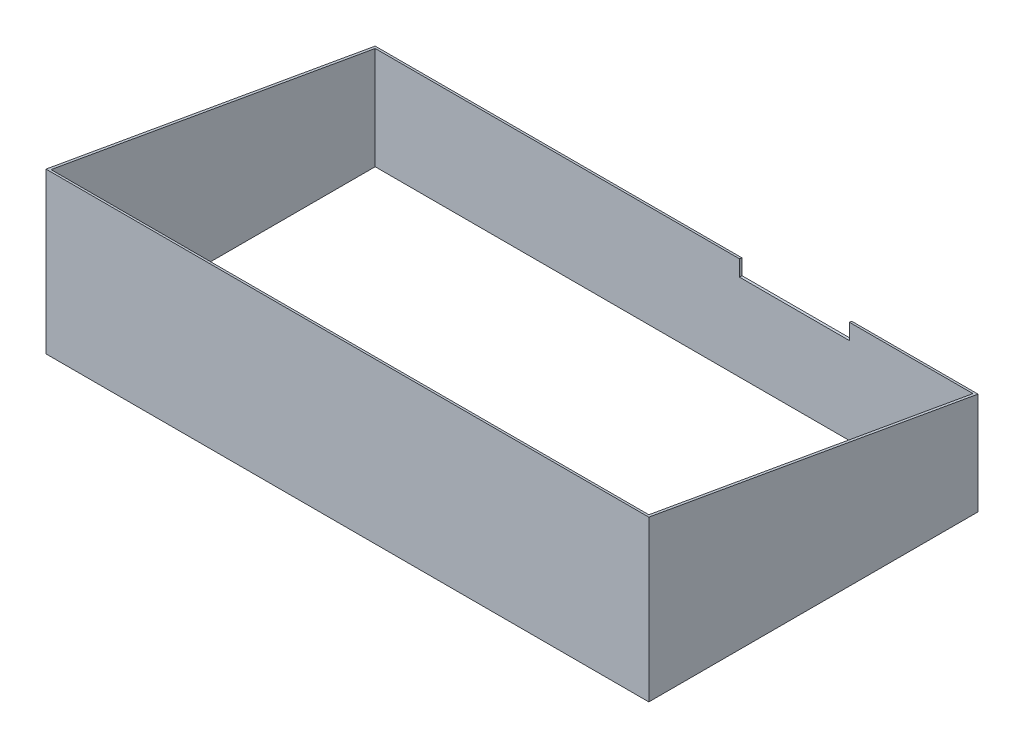
from build123d import *

# Parameters (mm, degrees)
BOSS_EXTRUDE1_DEPTH      = 759.38
BOSS_EXTRUDE1_DEPTH_BACK = 759.38
SHELL1_T                 = -6.35
CUT_EXTRUDE2_REACH       = 1192.172
SKETCH3_W                = 277
SKETCH3_H                = 50


with BuildPart() as part:
    # Sketch1 → Boss-Extrude1 (new, two sides: drawn at the far end of the back side and taken through both)
    with BuildSketch(Plane(origin=(0, 0, 0), x_dir=(0, 0, -1), z_dir=(1, 0, 0)).offset(-BOSS_EXTRUDE1_DEPTH_BACK)):
        Polygon((0, 403.229130413), (0, 0), (829.306608812, 0), (829.306608812, 257), align=None)
    extrude(amount=BOSS_EXTRUDE1_DEPTH + BOSS_EXTRUDE1_DEPTH_BACK)

    # Shell1
    shell1_openings = [part.faces().sort_by_distance(p)[0] for p in [
        (0, 0, -414.653304406),
        (0, 330.114565207, -414.653304406),
    ]]
    offset(amount=SHELL1_T, openings=shell1_openings, kind=Kind.INTERSECTION)

    # Sketch3 → Cut-Extrude2 (cut, up to next)
    with BuildSketch(Plane.XY.offset(-822.956608812), mode=Mode.PRIVATE) as cut_extrude2_sk1:
        with Locations((303.23, 243.119676327)):
            Rectangle(SKETCH3_W, SKETCH3_H)
    cut_extrude2_tool1 = extrude(cut_extrude2_sk1.sketch, amount=-CUT_EXTRUDE2_REACH, mode=Mode.PRIVATE) & part.part
    add(cut_extrude2_tool1.solids().sort_by_distance((303.23, 243.119676, -822.956609))[0], mode=Mode.SUBTRACT)


solid = part.part
